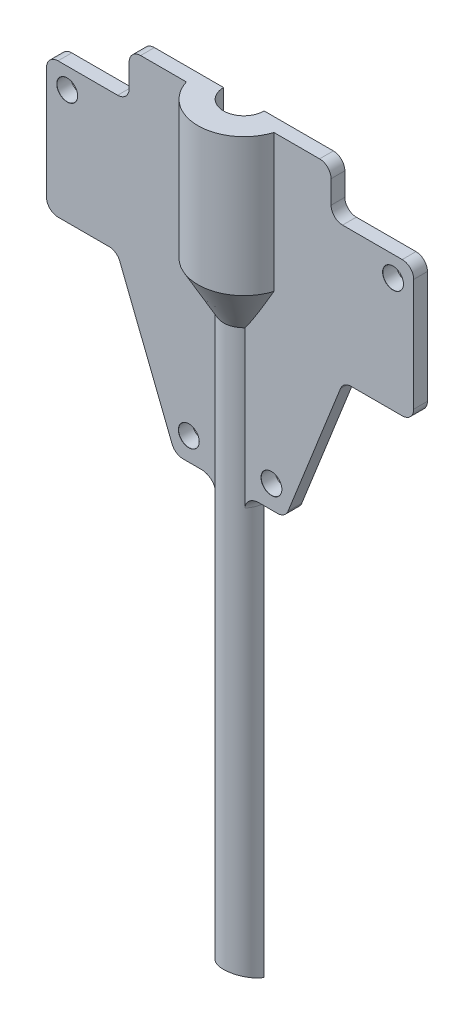
from build123d import *

# Parameters (mm, degrees)
BOSS_EXTRUDE1_DEPTH            = 3
SKETCH2_W                      = 2.725
SKETCH2_H                      = 93.5
REVOLVE1_ANGLE                 = 180
SKETCH2_3_W                    = 1.7
SKETCH2_3_H                    = 93.5
M4_CLEARANCE_HOLE1_D           = 4.5
M4_CLEARANCE_HOLE1_CSINK_D     = 4.55
M4_CLEARANCE_HOLE1_CSINK_ANGLE = 90
FILLET1_R                      = 4
FILLET2_R                      = 2.5
CUT_EXTRUDE2_DEPTH             = 5


with BuildPart() as part:
    # Sketch1 → Boss-Extrude1 (new body)
    with BuildSketch(Plane.XY):
        Polygon((-22, 0), (22, 0), (22, -10), (40, -10), (40, -39.5), (24.672961021, -39.5), (12, -71.5), (-12, -71.5), (-24.672961021, -39.5), (-40, -39.5), (-40, -10), (-22, -10), align=None)
    extrude(amount=BOSS_EXTRUDE1_DEPTH)

    # Sketch2 → Revolve1 (revolve)
    with BuildSketch(Plane.XY):
        with Locations((-3.0625, -118.25)):
            Rectangle(SKETCH2_W, SKETCH2_H)
        Polygon((-4.425, -40), (-4.425, -71.5), (-1.7, -71.5), (-1.7, -34), (-4.425, -34), (-4.425, 0), (-10, 0), (-10, -30), align=None)
    revolve(axis=Axis((0, 0, 0), (0, 1, 0)), revolution_arc=REVOLVE1_ANGLE)

    # Sketch2<3> → Cut-Revolve1 (revolve, cut)
    with BuildSketch(Plane.XY):
        with Locations((-0.85, -118.25)):
            Rectangle(SKETCH2_3_W, SKETCH2_3_H)
        Polygon((-1.7, -34), (-1.7, -71.5), (0, -71.5), (0, 0), (-4.425, 0), (-4.425, -34), align=None)
    revolve(axis=Axis((0, 0, 0), (0, -1, 0)), mode=Mode.SUBTRACT)

    # M4 Clearance Hole1 (through all)
    with Locations(Plane.XY.offset(3)):
        with Locations((-35.5, -14.5), (-9, -66.5), (9, -66.5), (35.5, -14.5)):
            CounterSinkHole(M4_CLEARANCE_HOLE1_D / 2, M4_CLEARANCE_HOLE1_CSINK_D / 2, counter_sink_angle=M4_CLEARANCE_HOLE1_CSINK_ANGLE)

    # Fillet1
    # the kernel refuses this fillet: 4 mm, written as the material it adds along each edge
    with BuildSketch(Plane(origin=(0, -34, 0), x_dir=(1, 0, 0), z_dir=(0, 0, -1))) as fillet1_piece_1:
        with BuildLine():
            CenterArc((0.425, -3.791355299), FILLET1_R, 0, 71.412652979)
            Line((1.7, 0), (1.7255, 0.075827106))
            ThreePointArc((1.7255, 0.075827106), (3.0625, 0.08), (4.425, 0.08))
            Line((4.425, 0.08), (4.505, 0))
            Line((4.505, 0), (4.505, -3.791355299))
            Line((4.505, -3.791355299), (4.425, -3.791355299))
        make_face()
    revolve(axis=Axis((0, -34, 0), (0, -1, 0)), revolution_arc=180)

    # Fillet2
    fillet2_edges = [part.edges().sort_by_distance(p)[0] for p in [
        (-22, 0, 1.5),
        (22, 0, 1.5),
        (22, -10, 1.5),
        (40, -10, 1.5),
        (40, -39.5, 1.5),
        (24.672961021, -39.5, 1.5),
        (12, -71.5, 1.5),
        (-12, -71.5, 1.5),
        (-24.672961021, -39.5, 1.5),
        (-40, -39.5, 1.5),
        (-40, -10, 1.5),
        (-22, -10, 1.5),
        (4.121541499, -71.5, 1.610441142),
        (-4.121541499, -71.5, 1.610441142),
    ]]
    fillet(fillet2_edges, radius=FILLET2_R)

    # Sketch9 → Cut-Extrude2 (cut, symmetric)
    with BuildSketch(Plane(origin=(0, 0, 0), x_dir=(0, 0, -1), z_dir=(1, 0, 0))):
        Polygon((-4.425, -162), (4.425, -165), (-4.425, -165), align=None)
    extrude(amount=CUT_EXTRUDE2_DEPTH, both=True, mode=Mode.SUBTRACT)


solid = part.part
